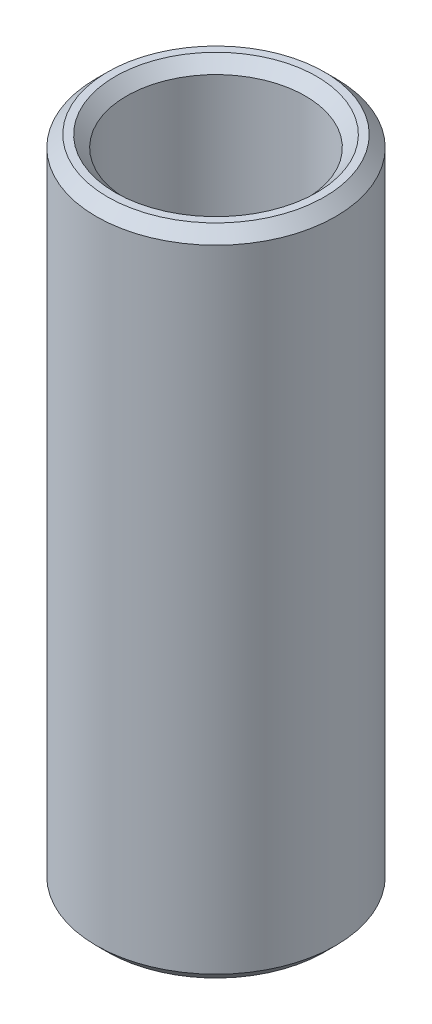
from build123d import *

# Parameters (mm, degrees)
SKETCH1_R           = 22.5
BOSS_EXTRUDE1_DEPTH = 122.955161222
SKETCH2_R           = 16.804775475
CUT_EXTRUDE1_DEPTH  = 128.005793849
CHAMFER1_SIZE       = 2.12645088


with BuildPart() as part:
    # Sketch1 → Boss-Extrude1 (new body)
    with BuildSketch(Plane(origin=(0, 0, 0), x_dir=(1, 0, 0), z_dir=(0, 1, 0))):
        Circle(SKETCH1_R)
    extrude(amount=BOSS_EXTRUDE1_DEPTH)

    # Sketch2 → Cut-Extrude1 (cut, through all)
    with BuildSketch(Plane(origin=(0, 0, 0), x_dir=(1, 0, 0), z_dir=(0, 1, 0))):
        Circle(SKETCH2_R)
    extrude(amount=CUT_EXTRUDE1_DEPTH, mode=Mode.SUBTRACT)

    # Chamfer1
    chamfer1_edges = [part.edges().sort_by_distance(p)[0] for p in [
        (-16.804775475, 122.955161222, 0),
        (-16.804775475, 0, 0),
        (-22.5, 0, 0),
        (-22.5, 122.955161222, 0),
    ]]
    chamfer(chamfer1_edges, length=CHAMFER1_SIZE)


solid = part.part
